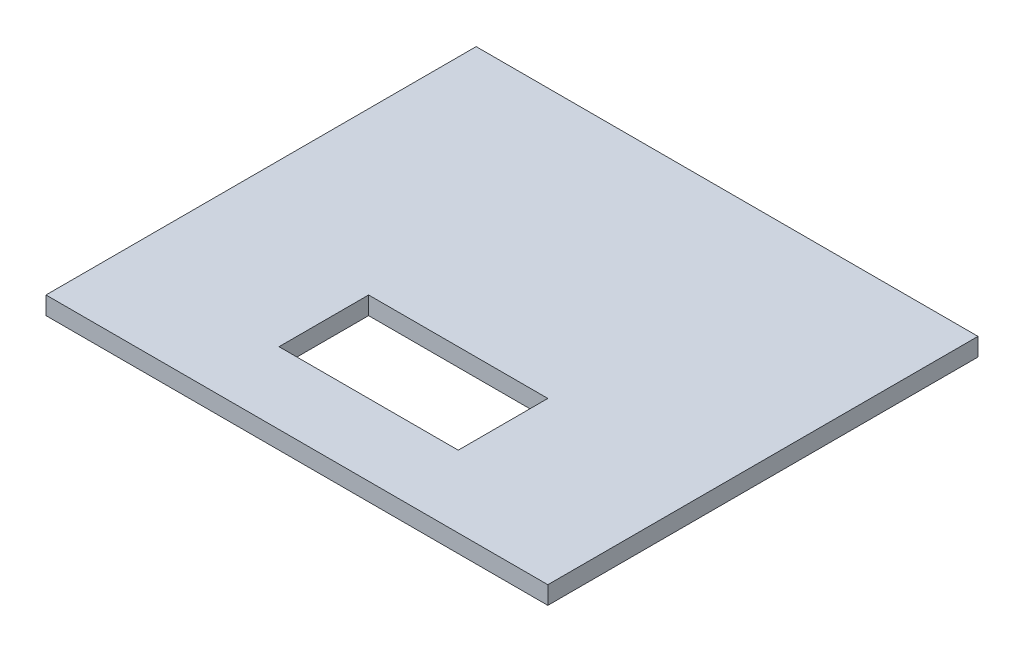
from build123d import *

# Parameters (mm, degrees)
SKETCH1_W           = 177.8
SKETCH1_H           = 152.4
BOSS_EXTRUDE1_DEPTH = 6.35
SKETCH2_W           = 63.5
SKETCH2_H           = 31.75
CUT_EXTRUDE1_DEPTH  = 118.260276735


with BuildPart() as part:
    # Sketch1 → Boss-Extrude1 (new body)
    with BuildSketch(Plane(origin=(0, 0, 0), x_dir=(1, 0, 0), z_dir=(0, 1, 0))):
        Rectangle(SKETCH1_W, SKETCH1_H)
    extrude(amount=BOSS_EXTRUDE1_DEPTH)

    # Sketch2 → Cut-Extrude1 (cut, through all)
    with BuildSketch(Plane(origin=(0, 6.35, 0), x_dir=(1, 0, 0), z_dir=(0, 1, 0))):
        with Locations((0, -34.925)):
            Rectangle(SKETCH2_W, SKETCH2_H)
    extrude(amount=-CUT_EXTRUDE1_DEPTH, mode=Mode.SUBTRACT)


solid = part.part
